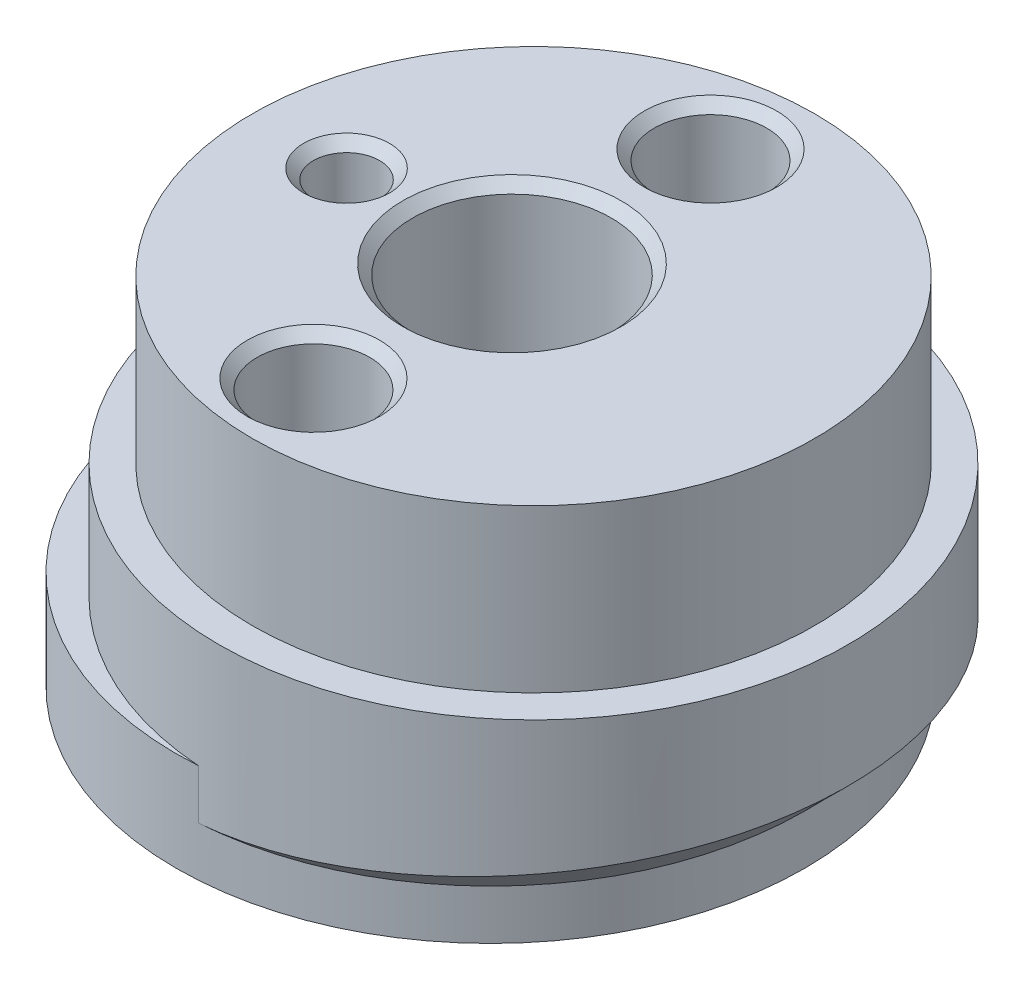
from build123d import *

# Parameters (mm, degrees)
SKETCH1_R            = 9.5
SKETCH1_R_2          = 3
BOSS_EXTRUDE1_DEPTH  = 3
SKETCH7_R            = 8.5
SKETCH7_R_2          = 3
BOSS_EXTRUDE5_DEPTH  = 8.4
SKETCH8_R            = 9.5
SKETCH8_R_2          = 8.5
BOSS_EXTRUDE6_DEPTH  = 3.5
CHAMFER1_SIZE        = 1.5
SKETCH12_R           = 3
SKETCH12_R_2         = 1
CUT_EXTRUDE4_DEPTH   = 18.978668035
M3_CLEARANCE_HOLE1_D = 3.4
CHAMFER2_SIZE        = 0.3


with BuildPart() as part:
    # Sketch1 → Boss-Extrude1 (new body)
    with BuildSketch(Plane(origin=(0, 0, 0), x_dir=(1, 0, 0), z_dir=(0, 1, 0))):
        with Locations(Location((-0.65, 0, 0), (0, 0, 270))):
            Circle(SKETCH1_R)
        with Locations(Location((0, 0, 0), (0, 0, 270))):
            Circle(SKETCH1_R_2, mode=Mode.SUBTRACT)
    extrude(amount=BOSS_EXTRUDE1_DEPTH)

    # Sketch7 → Boss-Extrude5 (add)
    with BuildSketch(Plane(origin=(0, 3, 0), x_dir=(1, 0, 0), z_dir=(0, 1, 0))):
        with Locations(Location((0.65, 0, 0), (0, 0, 42.437907805))):
            Circle(SKETCH7_R)
        with Locations(Location((0, 0, 0), (0, 0, 270))):
            Circle(SKETCH7_R_2, mode=Mode.SUBTRACT)
    extrude(amount=BOSS_EXTRUDE5_DEPTH)

    # Sketch8 → Boss-Extrude6 (add)
    with BuildSketch(Plane(origin=(0, 3, 0), x_dir=(1, 0, 0), z_dir=(0, 1, 0))):
        with Locations(Location((0.65, 0, 0), (0, 0, 93.923302734))):
            Circle(SKETCH8_R)
        with Locations(Location((0.65, 0, 0), (0, 0, 270))):
            Circle(SKETCH8_R_2, mode=Mode.SUBTRACT)
    extrude(amount=BOSS_EXTRUDE6_DEPTH)

    # Chamfer1
    # the kernel refuses this chamfer: 1.5 mm, written as the material it adds along each edge
    with BuildSketch(Plane(origin=(-0.65, 3, 0), x_dir=(-0.3317687677714116, 0, -0.9433607394477679), z_dir=(-0.9433607394477679, 0, 0.3317687677714116))) as chamfer1_piece_1_section:
        Polygon((9.5, CHAMFER1_SIZE), (9.5 + CHAMFER1_SIZE, 0), (9.5, 0), align=None)
    chamfer1_piece_1 = revolve(axis=Axis((-0.65, 3, 0), (0, -1, 0)), revolution_arc=218.752335407, mode=Mode.PRIVATE)
    chamfer1_piece_1 = chamfer1_piece_1 & Plane(origin=(0.65, 2.170447869, 0), x_dir=(-0.06842105263614455, 0, -0.9976565338613094), z_dir=(0, -1, 0)) * Cylinder(9.5, 44, mode=Mode.PRIVATE)
    add(chamfer1_piece_1)

    # Sketch12 → Cut-Extrude4 (cut, through all)
    with BuildSketch(Plane(origin=(0, 11.4, 0), x_dir=(1, 0, 0), z_dir=(0, 1, 0))):
        with Locations(Location((0, 0, 0), (0, 0, 270))):
            Circle(SKETCH12_R)
        with Locations(Location((-5, 0, 0), (0, 0, 270))):
            Circle(SKETCH12_R_2)
    extrude(amount=-CUT_EXTRUDE4_DEPTH, mode=Mode.SUBTRACT)

    # M3 Clearance Hole1 (through all)
    with Locations(Plane(origin=(0, 11.4, 0), x_dir=(1, 0, 0), z_dir=(0, 1, 0))):
        with Locations((0, 6), (0, -6)):
            Hole(M3_CLEARANCE_HOLE1_D / 2)

    # Chamfer2
    chamfer2_edges = [part.edges().sort_by_distance(p)[0] for p in [
        (0, 11.4, -3),
        (-5, 0, -1),
        (-5, 11.4, -1),
        (0, 0, -3),
        (1.7, 11.4, 6),
        (1.7, 0, 6),
        (1.7, 11.4, -6),
        (1.7, 0, -6),
    ]]
    chamfer(chamfer2_edges, length=CHAMFER2_SIZE)


solid = part.part
